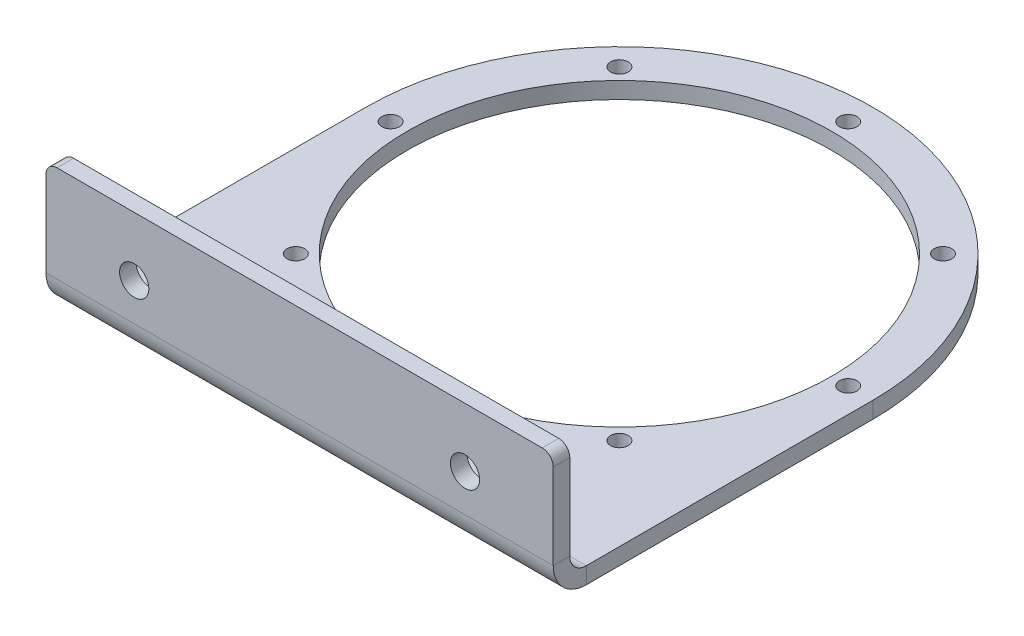
from build123d import *

# Parameters (mm, degrees)
SKETCH1_R                    = 38.5
SKETCH1_R_2                  = 1
BASE_FLANGE1_DEPTH           = 3
EDGE_FLANGE1_STRIP_W         = 18
EDGE_FLANGE1_STRIP_H         = 3
EDGE_FLANGE1_STRIP_CUT_DEPTH = 92
EDGE_FLANGE1_DEPTH           = 92
EDGE_FLANGE1_START           = 3
EDGE_FLANGE1_PROFILE_W       = 92
EDGE_FLANGE1_PROFILE_H       = 17.5
EDGE_FLANGE1_PROFILE_R       = 1
EDGE_FLANGE1_FLAT_DEPTH      = 3
FILLET1_R                    = 2
M3_CLEARANCE_HOLE1_D         = 3.2
M3_CLEARANCE_HOLE1_DEPTH     = 136
M3_CLEARANCE_HOLE1_TIP       = 0.96137699
M5_CLEARANCE_HOLE1_D         = 5.3
M5_CLEARANCE_HOLE1_DEPTH     = 136
M5_CLEARANCE_HOLE1_TIP       = 1.59228064


# Sheet-metal steps are written as plain solids
with BuildPart() as part:
    # Sketch1 → Base-Flange1 (new body)
    with BuildSketch(Plane(origin=(0, 0, 0), x_dir=(1, 0, 0), z_dir=(0, 1, 0))):
        with BuildLine():
            Line((-46, 0), (-46, -55))
            Line((-46, -55), (46, -55))
            Line((46, -55), (46, 0))
            ThreePointArc((46, 0), (0, 46), (-46, 0))
        make_face()
        with Locations(Location((0, 0, 0), (0, 0, 270))):
            Circle(SKETCH1_R, mode=Mode.SUBTRACT)
        with Locations(Location((0, 41.5, 0), (0, 0, 270))):
            Circle(SKETCH1_R_2, mode=Mode.SUBTRACT)
        with Locations(Location((29.344931419, 29.344931419, 0), (0, 0, 270))):
            Circle(SKETCH1_R_2, mode=Mode.SUBTRACT)
        with Locations(Location((41.5, 0, 0), (0, 0, 270))):
            Circle(SKETCH1_R_2, mode=Mode.SUBTRACT)
        with Locations(Location((29.344931419, -29.344931419, 0), (0, 0, 270))):
            Circle(SKETCH1_R_2, mode=Mode.SUBTRACT)
        with Locations(Location((0, -41.5, 0), (0, 0, 270))):
            Circle(SKETCH1_R_2, mode=Mode.SUBTRACT)
        with Locations(Location((-29.344931419, -29.344931419, 0), (0, 0, 270))):
            Circle(SKETCH1_R_2, mode=Mode.SUBTRACT)
        with Locations(Location((-41.5, 0, 0), (0, 0, 270))):
            Circle(SKETCH1_R_2, mode=Mode.SUBTRACT)
        with Locations(Location((-29.344931419, 29.344931419, 0), (0, 0, 270))):
            Circle(SKETCH1_R_2, mode=Mode.SUBTRACT)
    extrude(amount=-BASE_FLANGE1_DEPTH)

    # Edge-Flange1 strip (across the edge) → Edge-Flange1 strip cut (cut)
    with BuildSketch(Plane(origin=(-46, 0, 55), x_dir=(0, 0, -1), z_dir=(1, 0, 0))):
        with Locations((-6, -1.5)):
            Rectangle(EDGE_FLANGE1_STRIP_W, EDGE_FLANGE1_STRIP_H)
    extrude(amount=EDGE_FLANGE1_STRIP_CUT_DEPTH, mode=Mode.SUBTRACT)

    # Edge-Flange1 bend section (across the edge) → Edge-Flange1 (add)
    with BuildSketch(Plane(origin=(-46, 0, 55), x_dir=(0, 0, -1), z_dir=(1, 0, 0))):
        with BuildLine():
            Line((-3, 3), (0, 3))
            ThreePointArc((0, 3), (0.878679656, 0.878679656), (3, 0))
            Line((3, 0), (3, -3))
            ThreePointArc((3, -3), (-1.242640687, -1.242640687), (-3, 3))
        make_face()
    extrude(amount=EDGE_FLANGE1_DEPTH)

    # Edge-Flange1 profile (on flange) → Edge-Flange1 flat (add)
    with BuildSketch(Plane.XY.offset(55).offset(EDGE_FLANGE1_START)):
        with Locations((0, 11.75)):
            Rectangle(EDGE_FLANGE1_PROFILE_W, EDGE_FLANGE1_PROFILE_H)
        with Locations((-30, 9.8)):
            Circle(EDGE_FLANGE1_PROFILE_R, mode=Mode.SUBTRACT)
        with Locations((30, 9.8)):
            Circle(EDGE_FLANGE1_PROFILE_R, mode=Mode.SUBTRACT)
    extrude(amount=-EDGE_FLANGE1_FLAT_DEPTH)

    # Fillet1
    fillet1_edges = [part.edges().sort_by_distance(p)[0] for p in [
        (-46, 20.5, 56.5),
        (46, 20.5, 56.5),
    ]]
    fillet(fillet1_edges, radius=FILLET1_R)

    # M3 Clearance Hole1
    with Locations(Plane(origin=(0, 0, 0), x_dir=(1, 0, 0), z_dir=(0, 1, 0))):
        with Locations((-29.344931419, 29.344931419), (0, 41.5), (-41.5, 0), (-29.344931419, -29.344931419), (0, -41.5), (29.344931419, -29.344931419), (41.5, 0), (29.344931419, 29.344931419)):
            Hole(M3_CLEARANCE_HOLE1_D / 2, depth=M3_CLEARANCE_HOLE1_DEPTH)
            with Locations((0, 0, -(M3_CLEARANCE_HOLE1_DEPTH + M3_CLEARANCE_HOLE1_TIP / 2))):  # 118° drill point
                Cone(0, M3_CLEARANCE_HOLE1_D / 2, M3_CLEARANCE_HOLE1_TIP, mode=Mode.SUBTRACT)

    # M5 Clearance Hole1
    with Locations(Plane.XY.offset(58)):
        with Locations((-30, 9.8), (30, 9.8)):
            Hole(M5_CLEARANCE_HOLE1_D / 2, depth=M5_CLEARANCE_HOLE1_DEPTH)
            with Locations((0, 0, -(M5_CLEARANCE_HOLE1_DEPTH + M5_CLEARANCE_HOLE1_TIP / 2))):  # 118° drill point
                Cone(0, M5_CLEARANCE_HOLE1_D / 2, M5_CLEARANCE_HOLE1_TIP, mode=Mode.SUBTRACT)


solid = part.part
